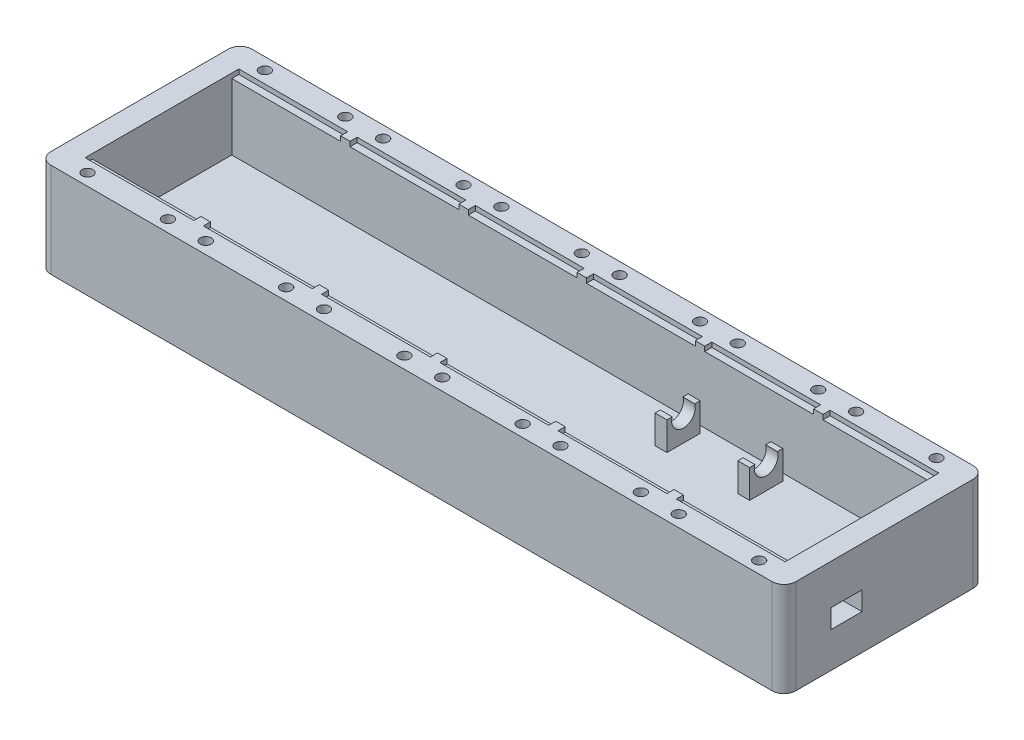
from build123d import *

# Parameters (mm, degrees)
SKIZZE2_W                       = 315
SKIZZE2_H                       = 40
AUFSATZ_LINEAR_AUSTRAGEN1_DEPTH = 85
SKIZZE4_W                       = 296
SKIZZE4_H                       = 59
SCHNITT_LINEAR_AUSTRAGEN1_DEPTH = 30
SKIZZE11_W                      = 46
SKIZZE11_H                      = 3
SKIZZE11_H_2                    = 3.008661904
SCHNITT_LINEAR_AUSTRAGEN4_DEPTH = 2
SKIZZE17_R                      = 2.3
SCHNITT_LINEAR_AUSTRAGEN6_DEPTH = 4
VERRUNDUNG2_R                   = 5
VERRUNDUNG3_R                   = 5
VERRUNDUNG4_R                   = 5
VERRUNDUNG6_R                   = 5
SKIZZE18_W                      = 13
SKIZZE18_H                      = 8
SCHNITT_LINEAR_AUSTRAGEN7_DEPTH = 10
SKIZZE20_W                      = 5
SKIZZE20_H                      = 14
AUFSATZ_LINEAR_AUSTRAGEN2_DEPTH = 12
SKIZZE21_R                      = 5
SCHNITT_LINEAR_AUSTRAGEN8_DEPTH = 71


with BuildPart() as part:
    # Skizze2 → Aufsatz-Linear austragen1 (new body)
    with BuildSketch(Plane.XY):
        with Locations((157.5, 20)):
            Rectangle(SKIZZE2_W, SKIZZE2_H)
    extrude(amount=AUFSATZ_LINEAR_AUSTRAGEN1_DEPTH)

    # Skizze4 → Schnitt-Linear austragen1 (cut)
    with BuildSketch(Plane(origin=(0, 40, 0), x_dir=(1, 0, 0), z_dir=(0, 1, 0))):
        with Locations((157.5, -42.5)):
            Rectangle(SKIZZE4_W, SKIZZE4_H)
    extrude(amount=-SCHNITT_LINEAR_AUSTRAGEN1_DEPTH, mode=Mode.SUBTRACT)

    # Skizze11 → Schnitt-Linear austragen4 (cut)
    with BuildSketch(Plane(origin=(0, 40, 0), x_dir=(1, 0, 0), z_dir=(0, 1, 0))):
        with Locations((32.5, -11.5)):
            Rectangle(SKIZZE11_W, SKIZZE11_H)
        with Locations((32.5, -73.5)):
            Rectangle(SKIZZE11_W, SKIZZE11_H)
        with Locations((82.5, -73.5)):
            Rectangle(SKIZZE11_W, SKIZZE11_H)
        with Locations((132.5, -73.504330952)):
            Rectangle(SKIZZE11_W, SKIZZE11_H_2)
        with Locations((182.5, -73.504330952)):
            Rectangle(SKIZZE11_W, SKIZZE11_H_2)
        with Locations((232.5, -73.5)):
            Rectangle(SKIZZE11_W, SKIZZE11_H)
        with Locations((282.5, -73.5)):
            Rectangle(SKIZZE11_W, SKIZZE11_H)
        with Locations((282.5, -11.5)):
            Rectangle(SKIZZE11_W, SKIZZE11_H)
        with Locations((232.5, -11.5)):
            Rectangle(SKIZZE11_W, SKIZZE11_H)
        with Locations((182.5, -11.5)):
            Rectangle(SKIZZE11_W, SKIZZE11_H)
        with Locations((132.5, -11.5)):
            Rectangle(SKIZZE11_W, SKIZZE11_H)
        with Locations((82.5, -11.5)):
            Rectangle(SKIZZE11_W, SKIZZE11_H)
    extrude(amount=-SCHNITT_LINEAR_AUSTRAGEN4_DEPTH, mode=Mode.SUBTRACT)

    # Skizze17 → Schnitt-Linear austragen6 (cut)
    with BuildSketch(Plane(origin=(0, 40, 0), x_dir=(1, 0, 0), z_dir=(0, 1, 0))):
        with Locations((49.5, -80)):
            Circle(SKIZZE17_R)
        with Locations((15.5, -80)):
            Circle(SKIZZE17_R)
        with Locations((15.5, -5)):
            Circle(SKIZZE17_R)
        with Locations((49.5, -5)):
            Circle(SKIZZE17_R)
        with Locations((65.5, -5)):
            Circle(SKIZZE17_R)
        with Locations((99.5, -5)):
            Circle(SKIZZE17_R)
        with Locations((65.5, -80)):
            Circle(SKIZZE17_R)
        with Locations((99.5, -80)):
            Circle(SKIZZE17_R)
        with Locations((115.5, -80)):
            Circle(SKIZZE17_R)
        with Locations((149.5, -80)):
            Circle(SKIZZE17_R)
        with Locations((165.5, -80)):
            Circle(SKIZZE17_R)
        with Locations((199.5, -80)):
            Circle(SKIZZE17_R)
        with Locations((215.5, -80)):
            Circle(SKIZZE17_R)
        with Locations((249.5, -80)):
            Circle(SKIZZE17_R)
        with Locations((265.5, -80)):
            Circle(SKIZZE17_R)
        with Locations((299.5, -80)):
            Circle(SKIZZE17_R)
        with Locations((299.5, -5)):
            Circle(SKIZZE17_R)
        with Locations((265.5, -5)):
            Circle(SKIZZE17_R)
        with Locations((249.5, -5)):
            Circle(SKIZZE17_R)
        with Locations((215.5, -5)):
            Circle(SKIZZE17_R)
        with Locations((199.5, -5)):
            Circle(SKIZZE17_R)
        with Locations((165.5, -5)):
            Circle(SKIZZE17_R)
        with Locations((149.5, -5)):
            Circle(SKIZZE17_R)
        with Locations((115.5, -5)):
            Circle(SKIZZE17_R)
    extrude(amount=-SCHNITT_LINEAR_AUSTRAGEN6_DEPTH, mode=Mode.SUBTRACT)

    # Verrundung2
    verrundung2_edges = [part.edges().sort_by_distance(p)[0] for p in [
        (0, 20, 85),
    ]]
    fillet(verrundung2_edges, radius=VERRUNDUNG2_R)

    # Verrundung3
    verrundung3_edges = [part.edges().sort_by_distance(p)[0] for p in [
        (0, 20, 0),
    ]]
    fillet(verrundung3_edges, radius=VERRUNDUNG3_R)

    # Verrundung4
    verrundung4_edges = [part.edges().sort_by_distance(p)[0] for p in [
        (315, 20, 0),
    ]]
    fillet(verrundung4_edges, radius=VERRUNDUNG4_R)

    # Verrundung6
    verrundung6_edges = [part.edges().sort_by_distance(p)[0] for p in [
        (315, 20, 85),
    ]]
    fillet(verrundung6_edges, radius=VERRUNDUNG6_R)

    # Skizze18 → Schnitt-Linear austragen7 (cut)
    with BuildSketch(Plane.ZY.offset(-305.5)):
        with Locations((58.5, 19)):
            Rectangle(SKIZZE18_W, SKIZZE18_H)
    extrude(amount=-SCHNITT_LINEAR_AUSTRAGEN7_DEPTH, mode=Mode.SUBTRACT)

    # Skizze20 → Aufsatz-Linear austragen2 (add)
    with BuildSketch(Plane(origin=(0, 10, 0), x_dir=(1, 0, 0), z_dir=(0, 1, 0))):
        with Locations((243, -23)):
            Rectangle(SKIZZE20_W, SKIZZE20_H)
        with Locations((208, -23)):
            Rectangle(SKIZZE20_W, SKIZZE20_H)
    extrude(amount=AUFSATZ_LINEAR_AUSTRAGEN2_DEPTH)

    # Skizze21 → Schnitt-Linear austragen8 (cut)
    with BuildSketch(Plane.ZY.offset(-205.5)):
        with Locations((23, 20.5)):
            Circle(SKIZZE21_R)
    extrude(amount=-SCHNITT_LINEAR_AUSTRAGEN8_DEPTH, mode=Mode.SUBTRACT)


solid = part.part
